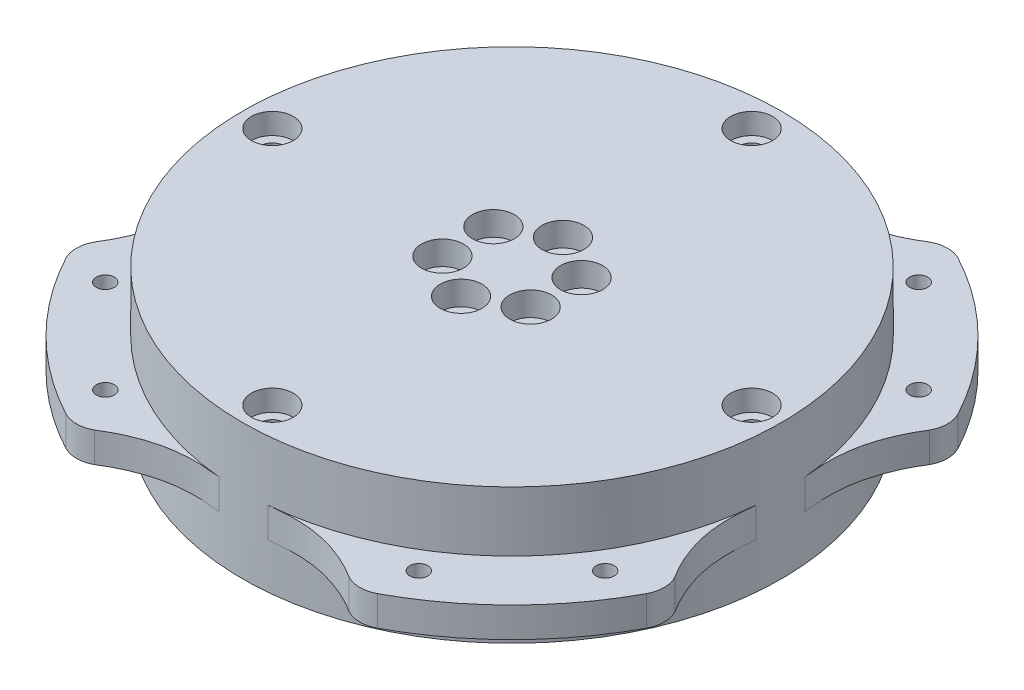
from build123d import *

# Parameters (mm, degrees)
ESQUISSE1_R             = 13
BOSS_EXTRU_1_DEPTH      = 7.5
ESQUISSE2_R             = 45
BOSS_EXTRU_2_DEPTH      = 3
ESQUISSE3_R             = 2
ENL_V_MAT_EXTRU_1_DEPTH = 20
ESQUISSE4_R             = 3.5
ENL_V_MAT_EXTRU_2_DEPTH = 4
BOSS_EXTRU_3_START      = 19.6
ESQUISSE7_R             = 45
ESQUISSE7_R_2           = 42.5
BOSS_EXTRU_3_DEPTH      = 19.6
BOSS_EXTRU_4_START      = 7.5
ESQUISSE8_R             = 42.5
ESQUISSE8_R_2           = 27.5
BOSS_EXTRU_4_DEPTH      = 7.5
ESQUISSE9_R             = 2
ENL_V_MAT_EXTRU_3_DEPTH = 7
ESQUISSE10_R            = 3.5
ENL_V_MAT_EXTRU_4_DEPTH = 7
BOSS_EXTRU_5_START      = -15
ESQUISSE11_R            = 1.5
BOSS_EXTRU_5_DEPTH      = 5
CONG_1_START            = -4.5
CONG_1_DEPTH            = 5


with BuildPart() as part:
    # Esquisse1 → Boss.-Extru.1 (new body)
    with BuildSketch(Plane(origin=(0, 0, 0), x_dir=(1, 0, 0), z_dir=(0, 1, 0))):
        with Locations(Location((0, 0, 0), (0, 0, 270))):
            Circle(ESQUISSE1_R)
    extrude(amount=BOSS_EXTRU_1_DEPTH)

    # Esquisse2 → Boss.-Extru.2 (add)
    with BuildSketch(Plane(origin=(0, 7.5, 0), x_dir=(1, 0, 0), z_dir=(0, 1, 0))):
        with Locations(Location((0, 0, 0), (0, 0, 270))):
            Circle(ESQUISSE2_R)
    extrude(amount=BOSS_EXTRU_2_DEPTH)

    # Esquisse3 → Enlèv. mat.-Extru.1 (cut)
    with BuildSketch(Plane.XZ):
        with Locations(Location((0, 8.5, 0), (0, 0, 270))):
            Circle(ESQUISSE3_R)
        with Locations(Location((7.361215932, 4.25, 0), (0, 0, 270))):
            Circle(ESQUISSE3_R)
        with Locations(Location((7.361215932, -4.25, 0), (0, 0, 270))):
            Circle(ESQUISSE3_R)
        with Locations(Location((0, -8.5, 0), (0, 0, 270))):
            Circle(ESQUISSE3_R)
        with Locations(Location((-7.361215932, -4.25, 0), (0, 0, 270))):
            Circle(ESQUISSE3_R)
        with Locations(Location((-7.361215932, 4.25, 0), (0, 0, 270))):
            Circle(ESQUISSE3_R)
    extrude(amount=-ENL_V_MAT_EXTRU_1_DEPTH, mode=Mode.SUBTRACT)

    # Esquisse4 → Enlèv. mat.-Extru.2 (cut)
    with BuildSketch(Plane(origin=(0, 10.5, 0), x_dir=(1, 0, 0), z_dir=(0, 1, 0))):
        with Locations(Location((0, 8.5, 0), (0, 0, 270))):
            Circle(ESQUISSE4_R)
        with Locations(Location((7.361215932, 4.25, 0), (0, 0, 270))):
            Circle(ESQUISSE4_R)
        with Locations(Location((7.361215932, -4.25, 0), (0, 0, 270))):
            Circle(ESQUISSE4_R)
        with Locations(Location((0, -8.5, 0), (0, 0, 270))):
            Circle(ESQUISSE4_R)
        with Locations(Location((-7.361215932, -4.25, 0), (0, 0, 270))):
            Circle(ESQUISSE4_R)
        with Locations(Location((-7.361215932, 4.25, 0), (0, 0, 270))):
            Circle(ESQUISSE4_R)
    extrude(amount=-ENL_V_MAT_EXTRU_2_DEPTH, mode=Mode.SUBTRACT)

    # Esquisse7 → Boss.-Extru.3 (add)
    with BuildSketch(Plane(origin=(0, 7.5, 0), x_dir=(-1, 0, 0), z_dir=(0, -1, 0)).offset(BOSS_EXTRU_3_START)):
        with Locations(Location((0, 0, 0), (0, 0, 90))):
            Circle(ESQUISSE7_R)
        with Locations(Location((0, 0, 0), (0, 0, 90))):
            Circle(ESQUISSE7_R_2, mode=Mode.SUBTRACT)
    extrude(amount=-BOSS_EXTRU_3_DEPTH)

    # Esquisse8 → Boss.-Extru.4 (add)
    with BuildSketch(Plane.XZ.offset(-7.5).offset(BOSS_EXTRU_4_START)):
        with Locations(Location((0, 0, 0), (0, 0, 270))):
            Circle(ESQUISSE8_R)
        with Locations(Location((0, 0, 0), (0, 0, 270))):
            Circle(ESQUISSE8_R_2, mode=Mode.SUBTRACT)
    extrude(amount=-BOSS_EXTRU_4_DEPTH)

    # Esquisse9 → Enlèv. mat.-Extru.3 (cut)
    with BuildSketch(Plane.XZ):
        with Locations(Location((0, 40, 0), (0, 0, 270))):
            Circle(ESQUISSE9_R)
        with Locations(Location((40, 0, 0), (0, 0, 270))):
            Circle(ESQUISSE9_R)
        with Locations(Location((0, -40, 0), (0, 0, 270))):
            Circle(ESQUISSE9_R)
        with Locations(Location((-40, 0, 0), (0, 0, 270))):
            Circle(ESQUISSE9_R)
    extrude(amount=-ENL_V_MAT_EXTRU_3_DEPTH, mode=Mode.SUBTRACT)

    # Esquisse10 → Enlèv. mat.-Extru.4 (cut)
    with BuildSketch(Plane.XZ.offset(-7)):
        with Locations(Location((-40, 0, 0), (0, 0, 270))):
            Circle(ESQUISSE10_R)
        with Locations(Location((40, 0, 0), (0, 0, 270))):
            Circle(ESQUISSE10_R)
        with Locations(Location((0, 40, 0), (0, 0, 270))):
            Circle(ESQUISSE10_R)
        with Locations(Location((0, -40, 0), (0, 0, 270))):
            Circle(ESQUISSE10_R)
    extrude(amount=-ENL_V_MAT_EXTRU_4_DEPTH, mode=Mode.SUBTRACT)

    # Esquisse11 → Boss.-Extru.5 (add)
    # profile 1 of 4: a face of its own
    with BuildSketch(Plane(origin=(0, 10.5, 0), x_dir=(1, 0, 0), z_dir=(0, 1, 0)).offset(BOSS_EXTRU_5_START)):
        with BuildLine():
            Line((19.03826038, 45.962426412), (17.220754456, 41.574578963))
            ThreePointArc((17.220754456, 41.574578963), (31.819805153, 31.819805153), (41.574578963, 17.220754456))
            Line((41.574578963, 17.220754456), (45.962426412, 19.03826038))
            ThreePointArc((45.962426412, 19.03826038), (48.758405499, 21.977900032), (48.453910176, 26.023423846))
            ThreePointArc((48.453910176, 26.023423846), (38.890872965, 38.890872965), (26.023423846, 48.453910176))
            ThreePointArc((26.023423846, 48.453910176), (21.977900032, 48.758405499), (19.03826038, 45.962426412))
        make_face()
        with Locations(Location((26.162950904, 41.71930009, 0), (0, 0, 270))):
            Circle(ESQUISSE11_R, mode=Mode.SUBTRACT)
        with Locations(Location((41.71930009, 26.162950904, 0), (0, 0, 270))):
            Circle(ESQUISSE11_R, mode=Mode.SUBTRACT)
    # profile 2 of 4: a face of its own
    with BuildSketch(Plane(origin=(0, 10.5, 0), x_dir=(1, 0, 0), z_dir=(0, 1, 0)).offset(BOSS_EXTRU_5_START)):
        with BuildLine():
            Line((45.962426412, -19.03826038), (41.574578963, -17.220754456))
            ThreePointArc((41.574578963, -17.220754456), (31.819805153, -31.819805153), (17.220754456, -41.574578963))
            Line((17.220754456, -41.574578963), (19.03826038, -45.962426412))
            ThreePointArc((19.03826038, -45.962426412), (21.977900032, -48.758405499), (26.023423846, -48.453910176))
            ThreePointArc((26.023423846, -48.453910176), (38.890872965, -38.890872965), (48.453910176, -26.023423846))
            ThreePointArc((48.453910176, -26.023423846), (48.758405499, -21.977900032), (45.962426412, -19.03826038))
        make_face()
        with Locations(Location((26.162950904, -41.71930009, 0), (0, 0, 270))):
            Circle(ESQUISSE11_R, mode=Mode.SUBTRACT)
        with Locations(Location((41.71930009, -26.162950904, 0), (0, 0, 270))):
            Circle(ESQUISSE11_R, mode=Mode.SUBTRACT)
    # profile 3 of 4: a face of its own
    with BuildSketch(Plane(origin=(0, 10.5, 0), x_dir=(1, 0, 0), z_dir=(0, 1, 0)).offset(BOSS_EXTRU_5_START)):
        with BuildLine():
            Line((-19.03826038, -45.962426412), (-17.220754456, -41.574578963))
            ThreePointArc((-17.220754456, -41.574578963), (-31.819805153, -31.819805153), (-41.574578963, -17.220754456))
            Line((-41.574578963, -17.220754456), (-45.962426412, -19.03826038))
            ThreePointArc((-45.962426412, -19.03826038), (-48.758405499, -21.977900032), (-48.453910176, -26.023423846))
            ThreePointArc((-48.453910176, -26.023423846), (-38.890872965, -38.890872965), (-26.023423846, -48.453910176))
            ThreePointArc((-26.023423846, -48.453910176), (-21.977900032, -48.758405499), (-19.03826038, -45.962426412))
        make_face()
        with Locations(Location((-41.71930009, -26.162950904, 0), (0, 0, 270))):
            Circle(ESQUISSE11_R, mode=Mode.SUBTRACT)
        with Locations(Location((-26.162950904, -41.71930009, 0), (0, 0, 270))):
            Circle(ESQUISSE11_R, mode=Mode.SUBTRACT)
    # profile 4 of 4: a face of its own
    with BuildSketch(Plane(origin=(0, 10.5, 0), x_dir=(1, 0, 0), z_dir=(0, 1, 0)).offset(BOSS_EXTRU_5_START)):
        with BuildLine():
            Line((-45.962426412, 19.03826038), (-41.574578963, 17.220754456))
            ThreePointArc((-41.574578963, 17.220754456), (-31.819805153, 31.819805153), (-17.220754456, 41.574578963))
            Line((-17.220754456, 41.574578963), (-19.03826038, 45.962426412))
            ThreePointArc((-19.03826038, 45.962426412), (-21.977900032, 48.758405499), (-26.023423846, 48.453910176))
            ThreePointArc((-26.023423846, 48.453910176), (-38.890872965, 38.890872965), (-48.453910176, 26.023423846))
            ThreePointArc((-48.453910176, 26.023423846), (-48.758405499, 21.977900032), (-45.962426412, 19.03826038))
        make_face()
        with Locations(Location((-26.162950904, 41.71930009, 0), (0, 0, 270))):
            Circle(ESQUISSE11_R, mode=Mode.SUBTRACT)
        with Locations(Location((-41.71930009, 26.162950904, 0), (0, 0, 270))):
            Circle(ESQUISSE11_R, mode=Mode.SUBTRACT)
    extrude(amount=BOSS_EXTRU_5_DEPTH)


with BuildPart() as cong_1_tool:
    # Congé1: read off the stored shape, not the designer's step
    # Congé1 outline → Congé1 (new body)
    with BuildSketch(Plane(origin=(0, 0, 0), x_dir=(1, 0, 0), z_dir=(0, 1, 0)).offset(CONG_1_START)):
        with BuildLine():
            add(Edge.make_bspline(
                [(-21.242584747, 48.427070577), (-20.510556933, 48.023261518), (-19.606844419, 47.325192253), (-15.032280406, 45.065924827), (-10.760888336, 44.321320902), (-6.91518351, 44.507915279), (-5.390936461, 44.696164597), (-4.051286986, 44.817263122)],
                knots=[0, 0, 0, 0, 0, 0, 0.5, 0.5, 1, 1, 1, 1, 1, 1], degree=5))
            ThreePointArc((-21.242584747, 48.427070577), (-19.930787622, 47.382241446), (-19.03826038, 45.962426412))
            Line((-19.03826038, 45.962426412), (-17.220754456, 41.574578963))
            ThreePointArc((-17.220754456, 41.574578963), (-10.75888874, 43.694923196), (-4.051286986, 44.817263122))
        make_face()
        with BuildLine():
            add(Edge.make_bspline(
                [(4.051286986, 44.817263122), (5.390936461, 44.696164597), (6.91518351, 44.507915279), (10.760888336, 44.321320902), (15.032280406, 45.065924827), (19.606844419, 47.325192253), (20.510556933, 48.023261518), (21.242584747, 48.427070577)],
                knots=[0, 0, 0, 0, 0, 0, 0.5, 0.5, 1, 1, 1, 1, 1, 1], degree=5))
            ThreePointArc((4.051286986, 44.817263122), (10.75888874, 43.694923196), (17.220754456, 41.574578963))
            Line((17.220754456, 41.574578963), (19.03826038, 45.962426412))
            ThreePointArc((19.03826038, 45.962426412), (19.930787622, 47.382241446), (21.242584747, 48.427070577))
        make_face()
        with BuildLine():
            ThreePointArc((-44.817263122, 4.051286986), (-43.694923196, 10.75888874), (-41.574578963, 17.220754456))
            Line((-41.574578963, 17.220754456), (-45.962426412, 19.03826038))
            ThreePointArc((-45.962426412, 19.03826038), (-47.382241446, 19.930787622), (-48.427070577, 21.242584747))
            add(Edge.make_bspline(
                [(-44.817263122, 4.051286986), (-44.696164597, 5.390936461), (-44.507915279, 6.91518351), (-44.321320902, 10.760888336), (-45.065924827, 15.032280406), (-47.325192253, 19.606844419), (-48.023261518, 20.510556933), (-48.427070577, 21.242584747)],
                knots=[0, 0, 0, 0, 0, 0, 0.5, 0.5, 1, 1, 1, 1, 1, 1], degree=5))
        make_face()
        with BuildLine():
            Line((45.962426412, 19.03826038), (41.574578963, 17.220754456))
            ThreePointArc((41.574578963, 17.220754456), (43.694923196, 10.75888874), (44.817263122, 4.051286986))
            add(Edge.make_bspline(
                [(48.427070577, 21.242584747), (48.023261518, 20.510556933), (47.325192253, 19.606844419), (45.065924827, 15.032280406), (44.321320902, 10.760888336), (44.507915279, 6.91518351), (44.696164597, 5.390936461), (44.817263122, 4.051286986)],
                knots=[0, 0, 0, 0, 0, 0, 0.5, 0.5, 1, 1, 1, 1, 1, 1], degree=5))
            ThreePointArc((48.427070577, 21.242584747), (47.382241446, 19.930787622), (45.962426412, 19.03826038))
        make_face()
        with BuildLine():
            ThreePointArc((-41.574578963, -17.220754456), (-43.694923196, -10.75888874), (-44.817263122, -4.051286986))
            add(Edge.make_bspline(
                [(-48.427070577, -21.242584747), (-48.023261518, -20.510556933), (-47.325192253, -19.606844419), (-45.065924827, -15.032280406), (-44.321320902, -10.760888336), (-44.507915279, -6.91518351), (-44.696164597, -5.390936461), (-44.817263122, -4.051286986)],
                knots=[0, 0, 0, 0, 0, 0, 0.5, 0.5, 1, 1, 1, 1, 1, 1], degree=5))
            ThreePointArc((-48.427070577, -21.242584747), (-47.382241446, -19.930787622), (-45.962426412, -19.03826038))
            Line((-45.962426412, -19.03826038), (-41.574578963, -17.220754456))
        make_face()
        with BuildLine():
            add(Edge.make_bspline(
                [(44.817263122, -4.051286986), (44.696164597, -5.390936461), (44.507915279, -6.91518351), (44.321320902, -10.760888336), (45.065924827, -15.032280406), (47.325192253, -19.606844419), (48.023261518, -20.510556933), (48.427070577, -21.242584747)],
                knots=[0, 0, 0, 0, 0, 0, 0.5, 0.5, 1, 1, 1, 1, 1, 1], degree=5))
            ThreePointArc((44.817263122, -4.051286986), (43.694923196, -10.75888874), (41.574578963, -17.220754456))
            Line((41.574578963, -17.220754456), (45.962426412, -19.03826038))
            ThreePointArc((45.962426412, -19.03826038), (47.382241446, -19.930787622), (48.427070577, -21.242584747))
        make_face()
        with BuildLine():
            ThreePointArc((-4.051286986, -44.817263122), (-10.75888874, -43.694923196), (-17.220754456, -41.574578963))
            Line((-17.220754456, -41.574578963), (-19.03826038, -45.962426412))
            ThreePointArc((-19.03826038, -45.962426412), (-19.930787622, -47.382241446), (-21.242584747, -48.427070577))
            add(Edge.make_bspline(
                [(-4.051286986, -44.817263122), (-5.390936461, -44.696164597), (-6.91518351, -44.507915279), (-10.760888336, -44.321320902), (-15.032280406, -45.065924827), (-19.606844419, -47.325192253), (-20.510556933, -48.023261518), (-21.242584747, -48.427070577)],
                knots=[0, 0, 0, 0, 0, 0, 0.5, 0.5, 1, 1, 1, 1, 1, 1], degree=5))
        make_face()
        with BuildLine():
            Line((19.03826038, -45.962426412), (17.220754456, -41.574578963))
            ThreePointArc((17.220754456, -41.574578963), (10.75888874, -43.694923196), (4.051286986, -44.817263122))
            add(Edge.make_bspline(
                [(21.242584747, -48.427070577), (20.510556933, -48.023261518), (19.606844419, -47.325192253), (15.032280406, -45.065924827), (10.760888336, -44.321320902), (6.91518351, -44.507915279), (5.390936461, -44.696164597), (4.051286986, -44.817263122)],
                knots=[0, 0, 0, 0, 0, 0, 0.5, 0.5, 1, 1, 1, 1, 1, 1], degree=5))
            ThreePointArc((21.242584747, -48.427070577), (19.930787622, -47.382241446), (19.03826038, -45.962426412))
        make_face()
    extrude(amount=CONG_1_DEPTH)


with BuildPart() as part_1:
    add(part.part)


with BuildPart() as part_2:
    # Congé1: joined with cong_1_tool
    add(part_1.part.fuse(cong_1_tool.part, tol=0.00001))


solid = part_2.part
